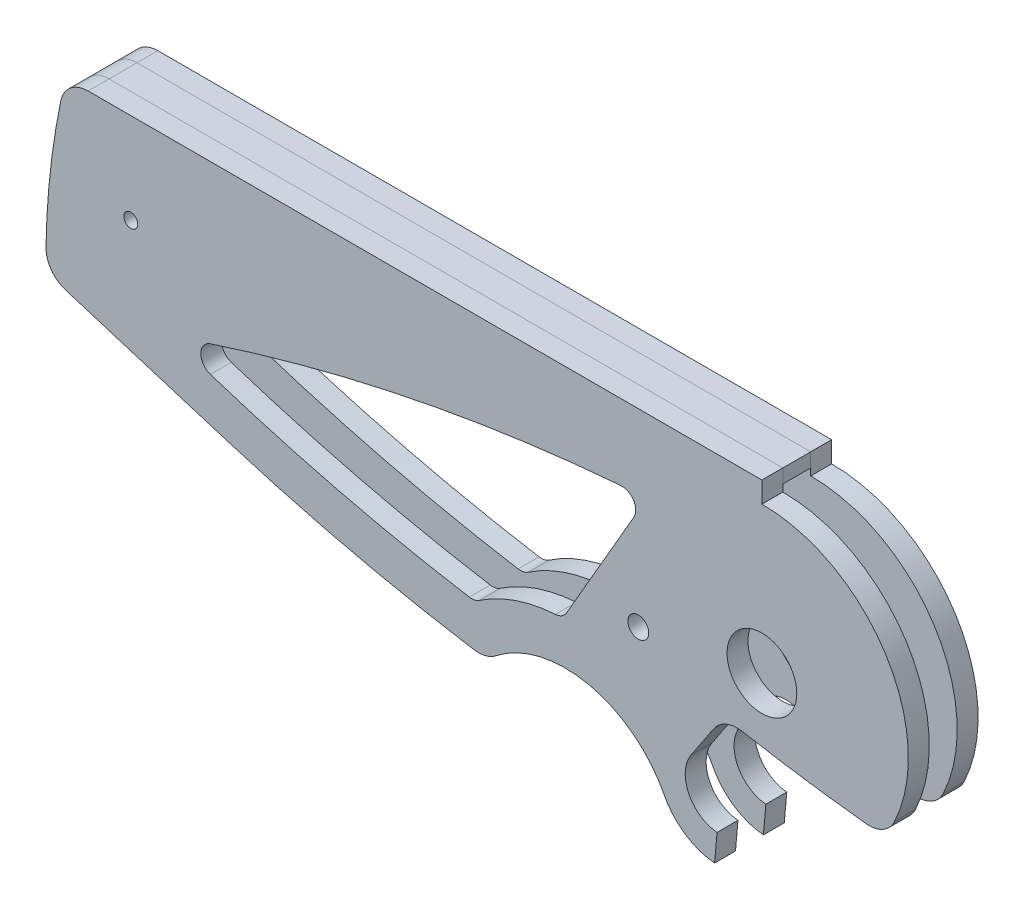
from build123d import *

# Parameters (mm, degrees)
SKICA1_R                 = 2.5
P_IDAT_VYSUNUT_M1_DEPTH  = 1.5
ODEBRAT_VYSUNUT_M3_DEPTH = 54.126672061
SKICA2_R                 = 0.75
SKICA2_R_2               = 0.5
ODEBRAT_VYSUNUT_M2_DEPTH = 54.126672061
P_IDAT_VYSUNUT_M2_DEPTH  = 1


with BuildPart() as part:
    # Skica1 → Přidat vysunutím1 (new body)
    with BuildSketch(Plane.XY.offset(1)):
        with BuildLine():
            Line((-3.451850397, -5.17306034), (-5.079542319, -7.612374783))
            ThreePointArc((-5.079542319, -7.612374783), (-5.253771545, -10.081902872), (-3.217889357, -11.490486745))
            Line((-3.217889357, -11.490486745), (-3.392200842, -13.482876141))
            ThreePointArc((-3.392200842, -13.482876141), (-5.507699887, -12.736501208), (-7, -11.061552813))
            ThreePointArc((-7, -11.061552813), (-12.421451418, -6.907005546), (-19.074569669, -8.452455647))
            ThreePointArc((-19.074569669, -8.452455647), (-19.810429728, -8.819128255), (-20.631627839, -8.858782909))
            ThreePointArc((-20.631627839, -8.858782909), (-29.612816832, -7.095755552), (-38.448343472, -4.707557447))
            Line((-38.448343472, -4.707557447), (-49.915705076, -1.172077587))
            ThreePointArc((-49.915705076, -1.172077587), (-50.944425281, -0.436513563), (-51.326233925, 0.769115673))
            ThreePointArc((-51.326233925, 0.769115673), (-51.024263074, 5.612344033), (-50.266302206, 10.405416394))
            ThreePointArc((-50.266302206, 10.405416394), (-49.570592062, 11.550940487), (-48.307823831, 12))
            Line((-48.307823831, 12), (0, 12))
            Line((0, 12), (0, 10.5))
            ThreePointArc((0, 10.5), (8.864205709, 5.628130874), (9.502649492, -4.466503402))
            ThreePointArc((9.502649492, -4.466503402), (8.672376262, -5.35932327), (7.478006155, -5.604192624))
            ThreePointArc((7.478006155, -5.604192624), (3.01210543, -5.04033823), (-1.430493256, -4.315412042))
            ThreePointArc((-1.430493256, -4.315412042), (-2.569395622, -4.442030631), (-3.451850397, -5.17306034))
        make_face()
        Circle(SKICA1_R, mode=Mode.SUBTRACT)
    extrude(amount=P_IDAT_VYSUNUT_M1_DEPTH)

    # Skica14 → Odebrat vysunutím3 (cut, through all)
    with BuildSketch(Plane.XY):
        with BuildLine():
            Line((-14.000954762, -3.250365002), (-9.180543984, 5.098831378))
            ThreePointArc((-9.180543984, 5.098831378), (-9.201183144, 6.132986878), (-10.126304066, 6.5956475))
            ThreePointArc((-10.126304066, 6.5956475), (-25.0093231, 4.513187085), (-39.5421575, 0.687272652))
            ThreePointArc((-39.5421575, 0.687272652), (-40.23080172, -0.263668209), (-39.540926846, -1.21371665))
            ThreePointArc((-39.540926846, -1.21371665), (-30.346748023, -3.835878825), (-20.981929874, -5.761713644))
            ThreePointArc((-20.981929874, -5.761713644), (-20.60514794, -5.752569661), (-20.258511168, -5.604612957))
            ThreePointArc((-20.258511168, -5.604612957), (-17.654944999, -4.313023149), (-14.803991078, -3.748379218))
            ThreePointArc((-14.803991078, -3.748379218), (-14.339939825, -3.600205269), (-14.000954762, -3.250365002))
        make_face()
    extrude(amount=ODEBRAT_VYSUNUT_M3_DEPTH, mode=Mode.SUBTRACT)

    # Skica2 → Odebrat vysunutím2 (cut, through all)
    with BuildSketch(Plane.XY):
        with Locations((-8.863269777, -1.562833599)):
            Circle(SKICA2_R)
        with Locations((-45.246630015, 5.5)):
            Circle(SKICA2_R_2)
    extrude(amount=ODEBRAT_VYSUNUT_M2_DEPTH, mode=Mode.SUBTRACT)


with BuildPart() as body_2:
    # Skica16 → Přidat vysunutím2 (new, symmetric)
    with BuildSketch(Plane(origin=(0, 0, 0), x_dir=(-1, 0, 0), z_dir=(0, 0, -1))):
        with BuildLine():
            Line((0, 12), (48.307823831, 12))
            ThreePointArc((48.307823831, 12), (49.570592062, 11.550940487), (50.266302206, 10.405416394))
            ThreePointArc((50.266302206, 10.405416394), (51.024263074, 5.612344033), (51.326233925, 0.769115673))
            ThreePointArc((51.326233925, 0.769115673), (51.324464931, 0.649874315), (51.31559221, 0.530950366))
            ThreePointArc((51.31559221, 0.530950366), (26.186308465, 8.356056534), (0, 11))
            Line((0, 11), (0, 12))
        make_face()
    extrude(amount=P_IDAT_VYSUNUT_M2_DEPTH, both=True)


with BuildPart() as body_3:
    # Zrcadlit1: mirrored copy
    add(part.part.mirror(Plane.XY))


solid = Compound([part.part, body_2.part, body_3.part])
